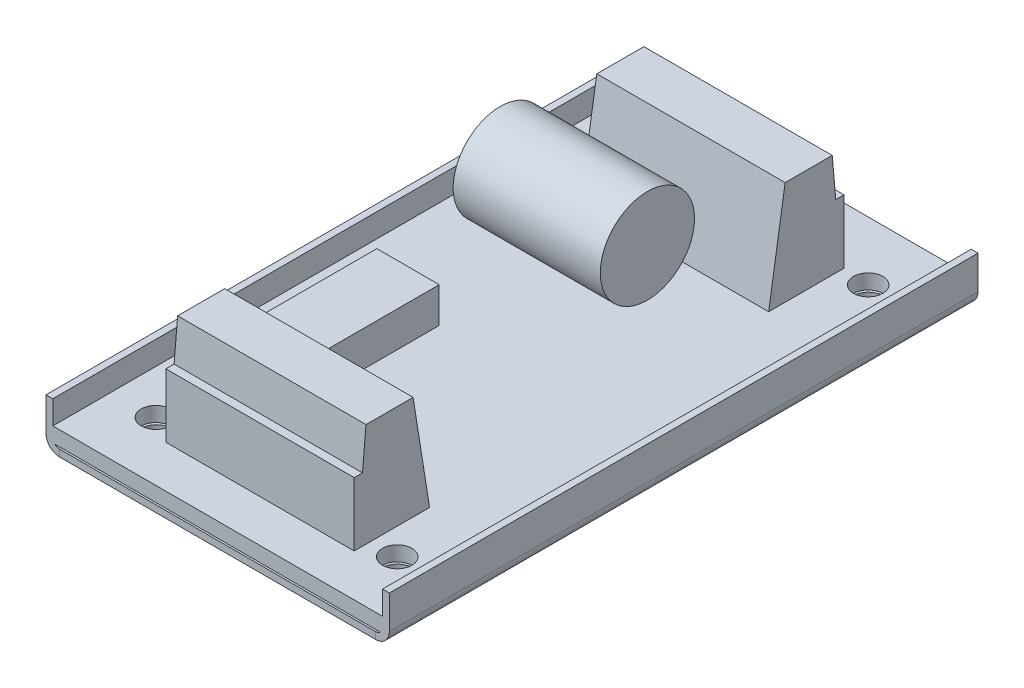
from build123d import *

# Parameters (mm, degrees)
SKETCH1_W                      = 35.56
SKETCH1_H                      = 63.5
BASE_FLANGE1_DEPTH             = 0.7366
EDGE_FLANGE1_STRIP_W           = 4.4196
EDGE_FLANGE1_STRIP_H           = 0.7366
EDGE_FLANGE1_STRIP_CUT_DEPTH   = 63.5
EDGE_FLANGE1_STRIP_2_W         = 4.4196
EDGE_FLANGE1_STRIP_2_H         = 0.7366
EDGE_FLANGE1_STRIP_CUT_2_DEPTH = 63.5
EDGE_FLANGE1_DEPTH             = 63.5
EDGE_FLANGE1_BEND_DEPTH        = 63.5
SKETCH12_W                     = 35.56
SKETCH12_H                     = 1.6002
BOSS_EXTRUDE1_DEPTH            = 63.5
SKETCH13_R                     = 1.5875
CUT_EXTRUDE1_DEPTH             = 38.104357905
BOSS_EXTRUDE2_DEPTH            = 10.16
BOSS_EXTRUDE3_START            = 2.54
SKETCH15_R                     = 5.08
BOSS_EXTRUDE3_DEPTH            = 15.875
SKETCH16_W                     = 6.731
SKETCH16_H                     = 16.637
BOSS_EXTRUDE4_DEPTH            = 3.81


# Sheet-metal steps are written as plain solids
with BuildPart() as part:
    # Sketch1 → Base-Flange1 (new body)
    with BuildSketch(Plane(origin=(0, 0, 0), x_dir=(1, 0, 0), z_dir=(0, 1, 0))):
        Rectangle(SKETCH1_W, SKETCH1_H)
    extrude(amount=-BASE_FLANGE1_DEPTH)

    # Edge-Flange1 strip (across the edge) → Edge-Flange1 strip cut (cut)
    with BuildSketch(Plane(origin=(-17.78, 0, -31.75), x_dir=(1, 0, 0), z_dir=(0, 0, 1))):
        with Locations((-1.4732, -0.3683)):
            Rectangle(EDGE_FLANGE1_STRIP_W, EDGE_FLANGE1_STRIP_H)
    extrude(amount=EDGE_FLANGE1_STRIP_CUT_DEPTH, mode=Mode.SUBTRACT)

    # Edge-Flange1 strip 2 (across the edge) → Edge-Flange1 strip cut 2 (cut)
    with BuildSketch(Plane(origin=(17.78, 0, 31.75), x_dir=(-1, 0, 0), z_dir=(0, 0, -1))):
        with Locations((-1.4732, -0.3683)):
            Rectangle(EDGE_FLANGE1_STRIP_2_W, EDGE_FLANGE1_STRIP_2_H)
    extrude(amount=EDGE_FLANGE1_STRIP_CUT_2_DEPTH, mode=Mode.SUBTRACT)

    # Edge-Flange1 section (across the edge) → Edge-Flange1 (add)
    with BuildSketch(Plane(origin=(-17.78, 0, -31.75), x_dir=(1, 0, 0), z_dir=(0, 0, 1))):
        with BuildLine():
            Line((-0.7366, 0.7366), (-0.7366, 4.3434))
            Line((-0.7366, 4.3434), (0, 4.3434))
            Line((0, 4.3434), (0, 0.7366))
            ThreePointArc((0, 0.7366), (0.215745145, 0.215745145), (0.7366, 0))
            Line((0.7366, 0), (0.7366, -0.7366))
            ThreePointArc((0.7366, -0.7366), (-0.30510971, -0.30510971), (-0.7366, 0.7366))
        make_face()
    extrude(amount=EDGE_FLANGE1_DEPTH)

    # Edge-Flange1 section 2 (across the edge) → Edge-Flange1 bend (add)
    with BuildSketch(Plane(origin=(17.78, 0, 31.75), x_dir=(-1, 0, 0), z_dir=(0, 0, -1))):
        with BuildLine():
            Line((-0.7366, 0.7366), (-0.7366, 4.3434))
            Line((-0.7366, 4.3434), (0, 4.3434))
            Line((0, 4.3434), (0, 0.7366))
            ThreePointArc((0, 0.7366), (0.215745145, 0.215745145), (0.7366, 0))
            Line((0.7366, 0), (0.7366, -0.7366))
            ThreePointArc((0.7366, -0.7366), (-0.30510971, -0.30510971), (-0.7366, 0.7366))
        make_face()
    extrude(amount=EDGE_FLANGE1_BEND_DEPTH)

    # Sketch12 → Boss-Extrude1 (add, through all)
    with BuildSketch(Plane.XY.offset(31.75)):
        with Locations((0, 1.0033)):
            Rectangle(SKETCH12_W, SKETCH12_H)
    extrude(amount=-BOSS_EXTRUDE1_DEPTH)

    # Sketch13 → Cut-Extrude1 (cut, through all)
    with BuildSketch(Plane.XZ.offset(0.7366)):
        with Locations((-13.0175, 25.4)):
            Circle(SKETCH13_R)
        with Locations((13.0175, 25.4)):
            Circle(SKETCH13_R)
        with Locations((13.0175, -25.4)):
            Circle(SKETCH13_R)
        with Locations((-13.0175, -25.4)):
            Circle(SKETCH13_R)
    extrude(amount=-CUT_EXTRUDE1_DEPTH, mode=Mode.SUBTRACT)

    # Sketch14 → Boss-Extrude2 (add, symmetric)
    with BuildSketch(Plane(origin=(0, 0, 0), x_dir=(0, 0, -1), z_dir=(1, 0, 0))):
        Polygon((17.526, 1.8034), (25.654, 1.8034), (25.654, 8.6614), (24.765, 8.6614), (24.384, 12.9794), (19.304, 12.9794), align=None)
        Polygon((-20.828, 12.9794), (-19.05, 1.8034), (-27.178, 1.8034), (-27.178, 8.6614), (-26.289, 8.6614), (-25.908, 12.9794), align=None)
    extrude(amount=BOSS_EXTRUDE2_DEPTH, both=True)

    # Sketch16 → Boss-Extrude4 (add)
    with BuildSketch(Plane(origin=(0, 1.8034, 0), x_dir=(1, 0, 0), z_dir=(0, 1, 0))):
        with Locations((-9.6901, -9.8425)):
            Rectangle(SKETCH16_W, SKETCH16_H)
    extrude(amount=BOSS_EXTRUDE4_DEPTH)


with BuildPart() as body_2:
    # Sketch15 → Boss-Extrude3 (new body)
    with BuildSketch(Plane(origin=(0, 0, 0), x_dir=(0, 0, -1), z_dir=(1, 0, 0)).offset(BOSS_EXTRUDE3_START)):
        with Locations((12.065, 6.8834)):
            Circle(SKETCH15_R)
    extrude(amount=-BOSS_EXTRUDE3_DEPTH)


solid = Compound([part.part, body_2.part])
